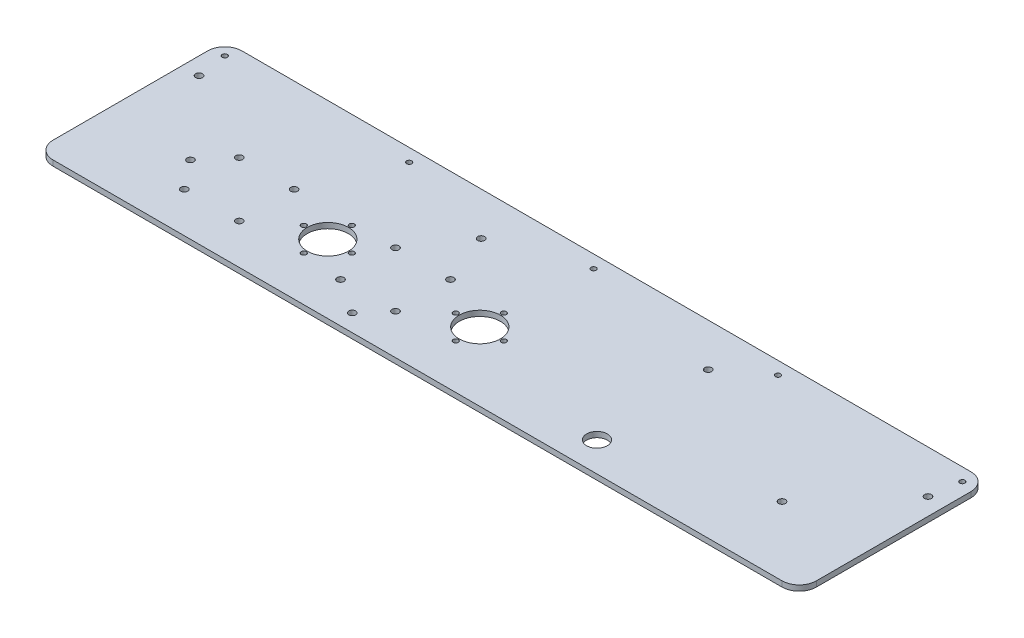
from build123d import *

# Parameters (mm, degrees)
SKETCH1_R           = 2
SKETCH1_R_2         = 1.5
SKETCH1_R_3         = 6
SKETCH1_R_4         = 12
BOSS_EXTRUDE1_DEPTH = 3.175
FILLET1_R           = 10
SKETCH2_R           = 2
CUT_EXTRUDE1_DEPTH  = 10


with BuildPart() as part:
    # Sketch1 → Boss-Extrude1 (new body)
    with BuildSketch(Plane(origin=(0, 0, 0), x_dir=(1, 0, 0), z_dir=(0, 1, 0))):
        Polygon((-26.799577535, 0), (417.700422465, 0), (417.700422465, 17.22815868), (417.700422465, 110), (-26.799577535, 110), align=None)
        with Locations((23.200422465, 40)):
            Circle(SKETCH1_R, mode=Mode.SUBTRACT)
        with Locations((89.200422465, 40)):
            Circle(SKETCH1_R_2, mode=Mode.SUBTRACT)
        with Locations((103.200422465, 26)):
            Circle(SKETCH1_R_2, mode=Mode.SUBTRACT)
        with Locations((117.200422465, 40)):
            Circle(SKETCH1_R_2, mode=Mode.SUBTRACT)
        with Locations((177.700422465, 40)):
            Circle(SKETCH1_R_2, mode=Mode.SUBTRACT)
        with Locations((191.700422465, 26)):
            Circle(SKETCH1_R_2, mode=Mode.SUBTRACT)
        with Locations((205.700422465, 40)):
            Circle(SKETCH1_R_2, mode=Mode.SUBTRACT)
        with Locations((367.700422465, 40)):
            Circle(SKETCH1_R, mode=Mode.SUBTRACT)
        with Locations((147.450422465, 10)):
            Circle(SKETCH1_R, mode=Mode.SUBTRACT)
        with Locations((282.700422465, 17.22815868)):
            Circle(SKETCH1_R_3, mode=Mode.SUBTRACT)
        with Locations((-16.799577535, 85)):
            Circle(SKETCH1_R, mode=Mode.SUBTRACT)
        with Locations((147.450422465, 85)):
            Circle(SKETCH1_R, mode=Mode.SUBTRACT)
        with Locations((103.200422465, 54)):
            Circle(SKETCH1_R_2, mode=Mode.SUBTRACT)
        with Locations((103.200422465, 40)):
            Circle(SKETCH1_R_4, mode=Mode.SUBTRACT)
        with Locations((279.700422465, 85)):
            Circle(SKETCH1_R, mode=Mode.SUBTRACT)
        with Locations((191.700422465, 54)):
            Circle(SKETCH1_R_2, mode=Mode.SUBTRACT)
        with Locations((191.700422465, 40)):
            Circle(SKETCH1_R_4, mode=Mode.SUBTRACT)
        with Locations((407.700422465, 85)):
            Circle(SKETCH1_R, mode=Mode.SUBTRACT)
        with Locations((-19.299577535, 102.5)):
            Circle(SKETCH1_R_2, mode=Mode.SUBTRACT)
        with Locations((88.075422465, 102.5)):
            Circle(SKETCH1_R_2, mode=Mode.SUBTRACT)
        with Locations((195.450422465, 102.5)):
            Circle(SKETCH1_R_2, mode=Mode.SUBTRACT)
        with Locations((302.825422465, 102.5)):
            Circle(SKETCH1_R_2, mode=Mode.SUBTRACT)
        with Locations((410.200422465, 102.5)):
            Circle(SKETCH1_R_2, mode=Mode.SUBTRACT)
    extrude(amount=BOSS_EXTRUDE1_DEPTH)

    # Fillet1
    fillet1_edges = [part.edges().sort_by_distance(p)[0] for p in [
        (417.700422465, 1.5875, -110),
        (417.700422465, 1.5875, 0),
        (-26.799577535, 1.5875, 0),
        (-26.799577535, 1.5875, -110),
    ]]
    fillet(fillet1_edges, radius=FILLET1_R)

    # Sketch2 → Cut-Extrude1 (cut)
    with BuildSketch(Plane(origin=(0, 3.175, 0), x_dir=(1, 0, 0), z_dir=(0, 1, 0))):
        with Locations((36.200422465, 55.40559892)):
            Circle(SKETCH2_R)
        with Locations((68.200422465, 55.40559892)):
            Circle(SKETCH2_R)
        with Locations((36.200422465, 23.40559892)):
            Circle(SKETCH2_R)
        with Locations((68.200422465, 23.40559892)):
            Circle(SKETCH2_R)
        with Locations((127.200422465, 55.40559892)):
            Circle(SKETCH2_R)
        with Locations((159.200422465, 55.40559892)):
            Circle(SKETCH2_R)
        with Locations((159.200422465, 23.40559892)):
            Circle(SKETCH2_R)
        with Locations((127.200422465, 23.40559892)):
            Circle(SKETCH2_R)
    extrude(amount=-CUT_EXTRUDE1_DEPTH, mode=Mode.SUBTRACT)


solid = part.part
